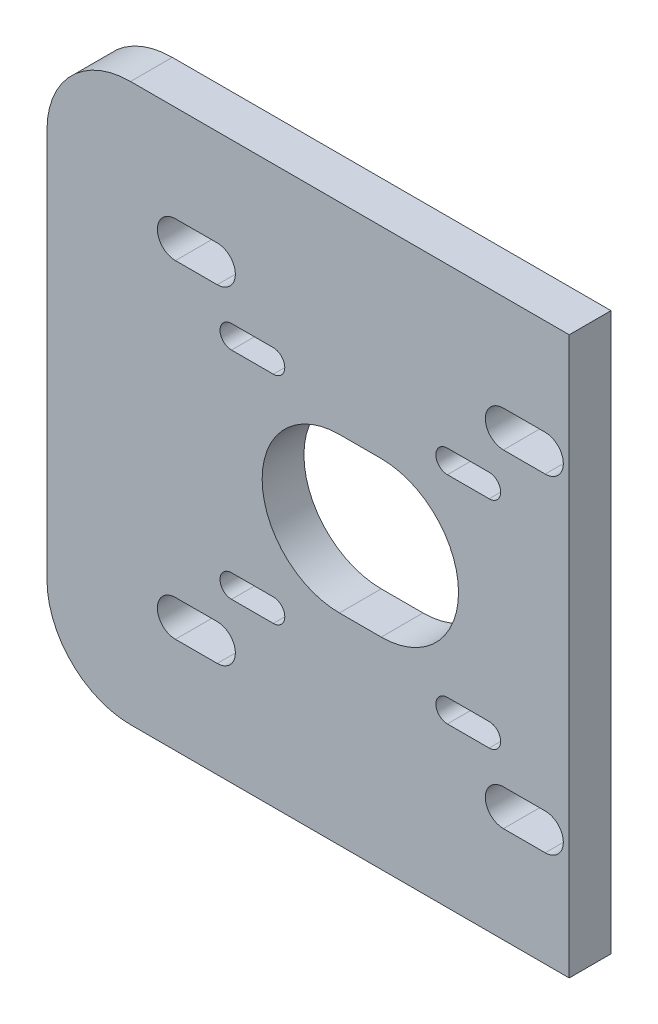
from build123d import *

# Parameters (mm, degrees)
CROQUIS1_W              = 75
CROQUIS1_H              = 80
SALIENTE_EXTRUIR1_DEPTH = 6
CORTAR_EXTRUIR1_DEPTH   = 110.822584198
REDONDEO1_R             = 12


with BuildPart() as part:
    # Croquis1 → Saliente-Extruir1 (new body)
    with BuildSketch(Plane.XY):
        with Locations((37.5, 40)):
            Rectangle(CROQUIS1_W, CROQUIS1_H)
    extrude(amount=SALIENTE_EXTRUIR1_DEPTH)

    # Croquis2 → Cortar-Extruir1 (cut, through all)
    with BuildSketch(Plane(origin=(0, 0, 0), x_dir=(-1, 0, 0), z_dir=(0, 0, -1))):
        with BuildLine():
            Line((-42, 28.9), (-48, 28.9))
            ThreePointArc((-48, 28.9), (-59.1, 40), (-48, 51.1))
            Line((-48, 51.1), (-42, 51.1))
            ThreePointArc((-42, 51.1), (-30.9, 40), (-42, 28.9))
        make_face()
        with BuildLine():
            Line((-26.5, 22.85), (-32.5, 22.85))
            ThreePointArc((-32.5, 22.85), (-34.15, 24.5), (-32.5, 26.15))
            Line((-32.5, 26.15), (-26.5, 26.15))
            ThreePointArc((-26.5, 26.15), (-24.85, 24.5), (-26.5, 22.85))
        make_face()
        with BuildLine():
            Line((-57.5, 53.85), (-63.5, 53.85))
            ThreePointArc((-63.5, 53.85), (-65.15, 55.5), (-63.5, 57.15))
            Line((-63.5, 57.15), (-57.5, 57.15))
            ThreePointArc((-57.5, 57.15), (-55.85, 55.5), (-57.5, 53.85))
        make_face()
        with BuildLine():
            Line((-57.5, 22.85), (-63.5, 22.85))
            ThreePointArc((-63.5, 22.85), (-65.15, 24.5), (-63.5, 26.15))
            Line((-63.5, 26.15), (-57.5, 26.15))
            ThreePointArc((-57.5, 26.15), (-55.85, 24.5), (-57.5, 22.85))
        make_face()
        with BuildLine():
            Line((-26.5, 53.85), (-32.5, 53.85))
            ThreePointArc((-32.5, 53.85), (-34.15, 55.5), (-32.5, 57.15))
            Line((-32.5, 57.15), (-26.5, 57.15))
            ThreePointArc((-26.5, 57.15), (-24.85, 55.5), (-26.5, 53.85))
        make_face()
        with BuildLine():
            Line((-18.45, 13.85), (-24.45, 13.85))
            ThreePointArc((-24.45, 13.85), (-27.05, 16.45), (-24.45, 19.05))
            Line((-24.45, 19.05), (-18.45, 19.05))
            ThreePointArc((-18.45, 19.05), (-15.85, 16.45), (-18.45, 13.85))
        make_face()
        with BuildLine():
            Line((-65.55, 13.85), (-71.55, 13.85))
            ThreePointArc((-71.55, 13.85), (-74.15, 16.45), (-71.55, 19.05))
            Line((-71.55, 19.05), (-65.55, 19.05))
            ThreePointArc((-65.55, 19.05), (-62.95, 16.45), (-65.55, 13.85))
        make_face()
        with BuildLine():
            Line((-18.45, 60.95), (-24.45, 60.95))
            ThreePointArc((-24.45, 60.95), (-27.05, 63.55), (-24.45, 66.15))
            Line((-24.45, 66.15), (-18.45, 66.15))
            ThreePointArc((-18.45, 66.15), (-15.85, 63.55), (-18.45, 60.95))
        make_face()
        with BuildLine():
            Line((-65.55, 60.95), (-71.55, 60.95))
            ThreePointArc((-71.55, 60.95), (-74.15, 63.55), (-71.55, 66.15))
            Line((-71.55, 66.15), (-65.55, 66.15))
            ThreePointArc((-65.55, 66.15), (-62.95, 63.55), (-65.55, 60.95))
        make_face()
    extrude(amount=-CORTAR_EXTRUIR1_DEPTH, mode=Mode.SUBTRACT)

    # Redondeo1
    redondeo1_edges = [part.edges().sort_by_distance(p)[0] for p in [
        (0, 0, 3),
        (0, 80, 3),
    ]]
    fillet(redondeo1_edges, radius=REDONDEO1_R)


solid = part.part
